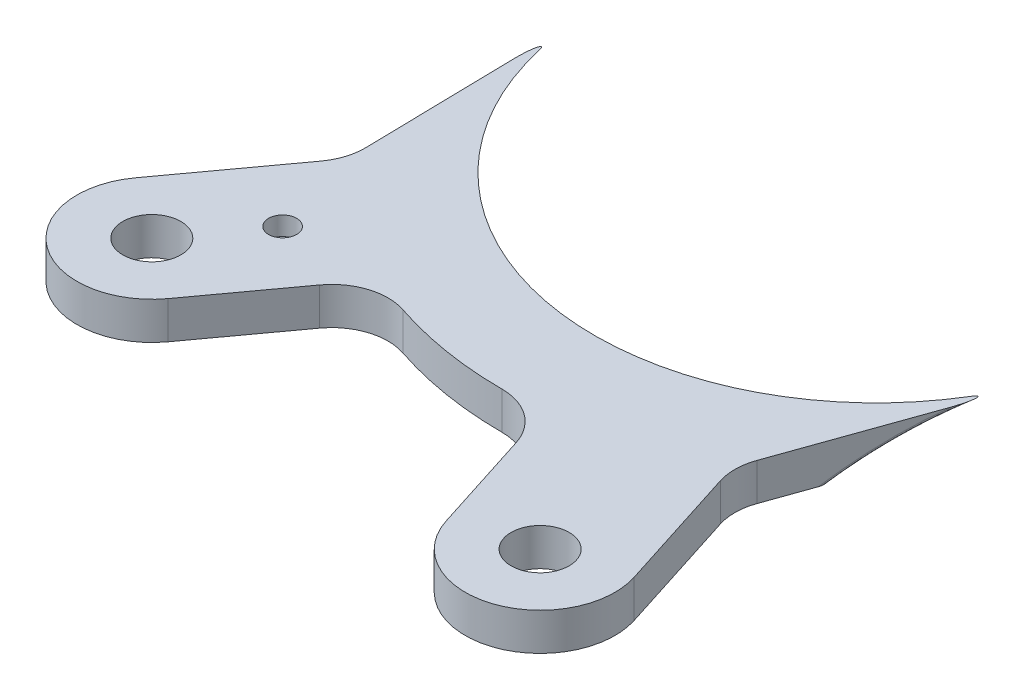
from build123d import *

# Parameters (mm, degrees)
SKETCH_1_R          = 1.55
EXTRUDE_1_DEPTH     = 2
FILLET_1_R          = 3
FILLET_2_R          = 0.2
SKETCH_3_R          = 0.75
CUT_EXTRUDE_1_DEPTH = 1


with BuildPart() as part:
    # 草图1 → 凸台-拉伸1 (new body)
    with BuildSketch(Plane(origin=(0, 0, 0), x_dir=(1, 0, 0), z_dir=(0, 1, 0))):
        with BuildLine():
            Line((-9.427629845, 12.118007633), (-14.205972572, 5.57250637))
            ThreePointArc((-14.205972572, 5.57250637), (-13.333741258, -0.01669863), (-7.744536258, 0.855532684))
            Line((-7.744536258, 0.855532684), (-2.966193531, 7.401033946))
            ThreePointArc((-2.966193531, 7.401033946), (2.156455687, 5.844533995), (7.508476858, 5.702771934))
            Line((7.508476858, 5.702771934), (9.973957748, -2.017173013))
            ThreePointArc((9.973957748, -2.017173013), (15.001264118, -4.610663069), (17.594754173, 0.416643301))
            Line((17.594754173, 0.416643301), (15.129273283, 8.136588247))
            Line((15.129273283, 8.136588247), (19.53886034, 20.548398832))
            ThreePointArc((19.53886034, 20.548398832), (2.94865648, 10.730730666), (-9.689752685, 25.287244194))
            Line((-9.689752685, 25.287244194), (-9.427629845, 12.118007633))
        make_face()
        with Locations(Location((13.784355961, -0.800264856, 0), (0, 0, 270))):
            Circle(SKETCH_1_R, mode=Mode.SUBTRACT)
        with Locations(Location((-10.975254415, 3.214019527, 0), (0, 0, 270))):
            Circle(SKETCH_1_R, mode=Mode.SUBTRACT)
    extrude(amount=EXTRUDE_1_DEPTH)

    # 圆角1
    fillet_1_edges = [part.edges().sort_by_distance(p)[0] for p in [
        (-9.427629845, 1, -12.118007633),
        (15.129273283, 1, -8.136588247),
        (7.508476858, 1, -5.702771934),
        (-2.966193531, 1, -7.401033946),
    ]]
    fillet(fillet_1_edges, radius=FILLET_1_R)

    # 草图2 → 切除-旋转1 (revolve, cut)
    with BuildSketch(Plane(origin=(5.357266973, 0, 0), x_dir=(0, -1, 0), z_dir=(-1, 0, 0))):
        with BuildLine():
            Line((43.030031962, -25.586742765), (-7.030031962, -25.586742765))
            ThreePointArc((-7.030031962, -25.586742765), (18, -0.556710804), (43.030031962, -25.586742765))
        make_face()
    revolve(axis=Axis((5.357266973, -43.030031962, -25.586742765), (0, 1, 0)), mode=Mode.SUBTRACT)

    # 圆角2
    # the kernel refuses this fillet: 0.2 mm, written as the material it takes off along each edge
    with BuildSketch(Plane(origin=(19.53886034, -18, -20.548398832), x_dir=(-0.1606859623720409, 0.8772773226728997, 0.4522880947144644), z_dir=(-0.29368936055859224, -0.47998385298244073, 0.8266571601158587))) as fillet_2_piece_1:
        with BuildLine():
            CenterArc((20.396862817, 0.2), FILLET_2_R, 143.943391902, 126.056608098)
            Line((20.396862817, 0), (20, 0))
            ThreePointArc((20, 0), (20.118215024, 0.158394169), (20.235175643, 0.317716854))
        make_face()
    revolve(axis=Axis((19.53886034, -18, -20.548398832), (-0.9422985625539585, 0, -0.3347736832678813)), revolution_arc=31.526759785, mode=Mode.SUBTRACT)
    with BuildSketch(Plane(origin=(-9.689752685, -18, -25.287244194), x_dir=(-0.0009868358148414909, 0.9987697013737694, -0.049579328079614966), z_dir=(-0.01987575403412073, -0.049589148185379746, -0.9985719156794987))) as fillet_2_piece_2:
        with BuildLine():
            CenterArc((20.396862817, 0.2), FILLET_2_R, 143.943391902, 126.056608098)
            ThreePointArc((20.235175643, 0.317716854), (20.118215024, 0.158394169), (20, 0))
            Line((20, 0), (20.396862817, 0))
        make_face()
    revolve(axis=Axis((-9.689752685, -18, -25.287244194), (0.9998019706705172, 0, -0.019900237268694068)), revolution_arc=31.526762102, mode=Mode.SUBTRACT)

    # 草图3 → 切除-拉伸1 (cut)
    with BuildSketch(Plane(origin=(0, 2, 0), x_dir=(1, 0, 0), z_dir=(0, 1, 0))):
        with Locations(Location((-8.027145861, 7.252417223, 0), (0, 0, 270))):
            Circle(SKETCH_3_R)
    extrude(amount=-CUT_EXTRUDE_1_DEPTH, mode=Mode.SUBTRACT)


solid = part.part
